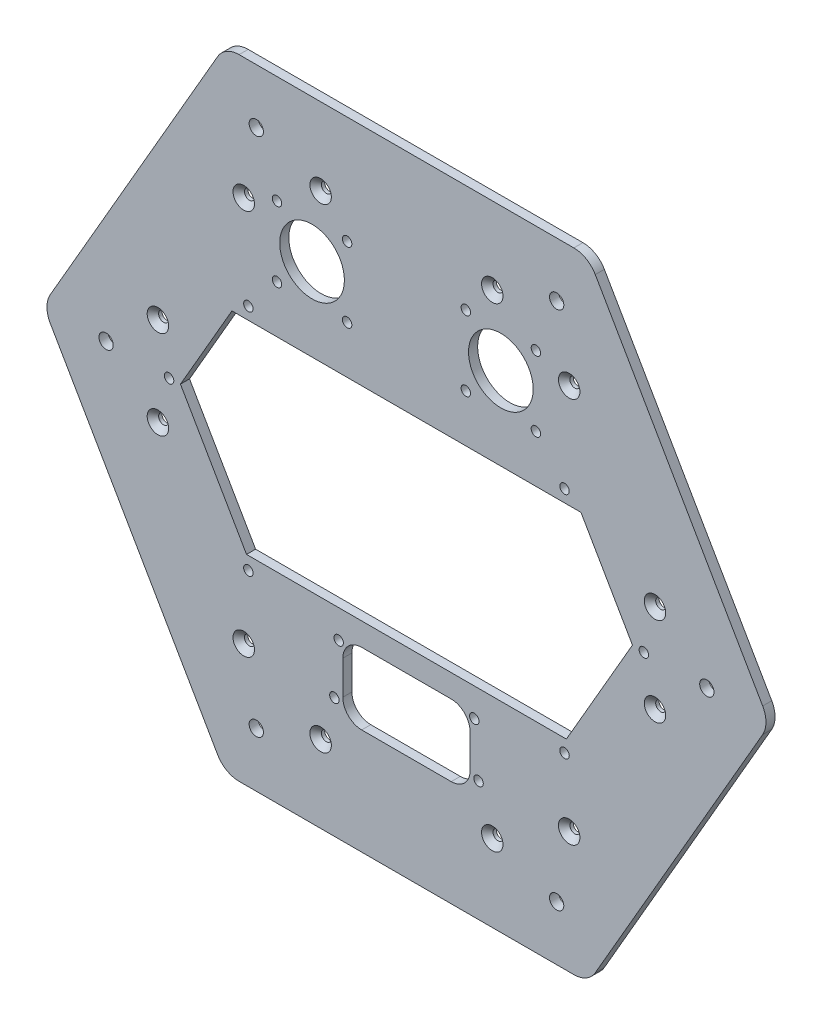
from build123d import *

# Parameters (mm, degrees)
FLANGE_BASE1_DEPTH               = 3.175
ESBO_O6_R                        = 1.65
CORTE_EXTRUS_O1_DEPTH            = 10
ESBO_O8_R                        = 11.3
ESBO_O8_R_2                      = 1.65
CORTE_EXTRUS_O3_DEPTH            = 10
PADR_OCIRCULAR1_COUNT            = 4
ESBO_O7_R                        = 1.75
CORTE_EXTRUS_O2_DEPTH            = 10
CHANFRO1_SIZE                    = 2
PADR_OCIRCULAR2_COUNT            = 6
CHANFRO1_OF_PADR_OCIRCULAR2_SIZE = 2
ESPELHAR1_COPY_1_SKETCH_R        = 11.3
ESPELHAR1_COPY_1_SKETCH_R_2      = 1.65
ESPELHAR1_COPY_1_DEPTH           = 10
ESPELHAR1_COPY_2_SKETCH_R        = 11.3
ESPELHAR1_COPY_2_SKETCH_R_2      = 1.65
ESPELHAR1_COPY_2_DEPTH           = 10
ESPELHAR1_COPY_3_SKETCH_R        = 11.3
ESPELHAR1_COPY_3_SKETCH_R_2      = 1.65
ESPELHAR1_COPY_3_DEPTH           = 10
ESBO_O11_R                       = 2.5
CORTE_EXTRUS_O5_DEPTH            = 10
ESBO_O12_R                       = 1.65
CORTE_EXTRUS_O6_DEPTH            = 10
ESBO_O13_W                       = 376.359651272
ESBO_O13_H                       = 358.929615965
CORTE_EXTRUS_O7_DEPTH            = 10
CAVIDADE1_START                  = -5
CAVIDADE1_DEPTH                  = 10


# Read off the part's stored shape, not the designer's step: Cavidade1
# Sheet-metal steps are written as plain solids
with BuildPart() as part:
    # Esboço1 → Flange-base1 (new body)
    with BuildSketch(Plane.XY):
        Polygon((63.508529611, 110), (127.017059222, 0), (63.508529611, -110), (-63.508529611, -110), (-127.017059222, 0), (-63.508529611, 110), align=None)
        Polygon((61, 31.176914536), (-61, 31.176914536), (-79, 0), (-55.905989232, -40), (55.905989232, -40), (79, 0), align=None, mode=Mode.SUBTRACT)
    extrude(amount=-FLANGE_BASE1_DEPTH)

    # Esboço6 → Corte-extrusão1 (cut)
    with BuildSketch(Plane.XY):
        with BuildLine():
            Line((15.65, -73), (-15.65, -73))
            ThreePointArc((-15.65, -73), (-20.316904756, -71.066904756), (-22.25, -66.4))
            Line((-22.25, -66.4), (-22.25, -54.6))
            ThreePointArc((-22.25, -54.6), (-20.316904756, -49.933095244), (-15.65, -48))
            Line((-15.65, -48), (15.65, -48))
            ThreePointArc((15.65, -48), (20.316904756, -49.933095244), (22.25, -54.6))
            Line((22.25, -54.6), (22.25, -66.4))
            ThreePointArc((22.25, -66.4), (20.316904756, -71.066904756), (15.65, -73))
        make_face()
        with Locations((-23.7, -49.9)):
            Circle(ESBO_O6_R)
        with Locations((23.7, -49.9)):
            Circle(ESBO_O6_R)
        with Locations((25.2, -68)):
            Circle(ESBO_O6_R)
        with Locations((-25.2, -68)):
            Circle(ESBO_O6_R)
    extrude(amount=-CORTE_EXTRUS_O1_DEPTH, mode=Mode.SUBTRACT)

    # Esboço8 → Corte-extrusão3 (cut)
    with BuildSketch(Plane.XY):
        with Locations((-33, 60.0982)):
            Circle(ESBO_O8_R)
        with Locations((-20.75, 47.8482)):
            Circle(ESBO_O8_R_2)
    corte_extrus_o3 = extrude(amount=-CORTE_EXTRUS_O3_DEPTH, mode=Mode.SUBTRACT)

    # PadrãoCircular1: Corte-extrusão3 ×4 about axis
    padr_ocircular1_axis = Axis((-33, 60.0982, 0), (0, 0, 1))
    for i in range(1, PADR_OCIRCULAR1_COUNT):
        add(corte_extrus_o3.rotate(padr_ocircular1_axis, i * 360 / PADR_OCIRCULAR1_COUNT), mode=Mode.SUBTRACT)

    # Esboço7 → Corte-extrusão2 (cut)
    with BuildSketch(Plane.XY):
        with Locations((-30, -83)):
            Circle(ESBO_O7_R)
        with Locations((30, -83)):
            Circle(ESBO_O7_R)
    corte_extrus_o2 = extrude(amount=-CORTE_EXTRUS_O2_DEPTH, mode=Mode.SUBTRACT)

    # Chanfro1
    chanfro1_edges = [part.edges().sort_by_distance(p)[0] for p in [
        (-31.75, -83, 0),
        (28.25, -83, 0),
    ]]
    chamfer(chanfro1_edges, length=CHANFRO1_SIZE)

    # PadrãoCircular2: Corte-extrusão2 ×6 about axis
    padr_ocircular2_axis = Axis((0, 0, 0), (0, 0, 1))
    for i in range(1, PADR_OCIRCULAR2_COUNT):
        add(corte_extrus_o2.rotate(padr_ocircular2_axis, i * 360 / PADR_OCIRCULAR2_COUNT), mode=Mode.SUBTRACT)

    # Chanfro1 of PadrãoCircular2
    chanfro1_of_padr_ocircular2_edges = [part.edges().sort_by_distance(p)[0] for p in [
        (56.005108514, -68.99630657, 0),
        (86.005108514, -17.034782343, 0),
        (87.755108514, 14.00369343, 0),
        (57.755108514, 65.965217657, 0),
        (31.75, 83, 0),
        (-28.25, 83, 0),
        (-56.005108514, 68.99630657, 0),
        (-86.005108514, 17.034782343, 0),
        (-87.755108514, -14.00369343, 0),
        (-57.755108514, -65.965217657, 0),
    ]]
    chamfer(chanfro1_of_padr_ocircular2_edges, length=CHANFRO1_OF_PADR_OCIRCULAR2_SIZE)

    # Espelhar1: Corte-extrusão3 across plane
    add(corte_extrus_o3.mirror(Plane(origin=(0, 0, 0), x_dir=(0, 0, 1), z_dir=(1, 0, 0))), mode=Mode.SUBTRACT)

    # Espelhar1 copy 1 sketch → Espelhar1 copy 1 (cut)
    with BuildSketch(Plane(origin=(-27.0982, 93.0982, 0), x_dir=(0, 1, 0), z_dir=(0, 0, 1))):
        with Locations((-33, -60.0982)):
            Circle(ESPELHAR1_COPY_1_SKETCH_R)
        with Locations((-20.75, -47.8482)):
            Circle(ESPELHAR1_COPY_1_SKETCH_R_2)
    extrude(amount=-ESPELHAR1_COPY_1_DEPTH, mode=Mode.SUBTRACT)

    # Espelhar1 copy 2 sketch → Espelhar1 copy 2 (cut)
    with BuildSketch(Plane(origin=(66, 120.1964, 0), x_dir=(1, 0, 0), z_dir=(0, 0, 1))):
        with Locations((-33, -60.0982)):
            Circle(ESPELHAR1_COPY_2_SKETCH_R)
        with Locations((-20.75, -47.8482)):
            Circle(ESPELHAR1_COPY_2_SKETCH_R_2)
    extrude(amount=-ESPELHAR1_COPY_2_DEPTH, mode=Mode.SUBTRACT)

    # Espelhar1 copy 3 sketch → Espelhar1 copy 3 (cut)
    with BuildSketch(Plane(origin=(93.0982, 27.0982, 0), x_dir=(0, -1, 0), z_dir=(0, 0, 1))):
        with Locations((-33, -60.0982)):
            Circle(ESPELHAR1_COPY_3_SKETCH_R)
        with Locations((-20.75, -47.8482)):
            Circle(ESPELHAR1_COPY_3_SKETCH_R_2)
    extrude(amount=-ESPELHAR1_COPY_3_DEPTH, mode=Mode.SUBTRACT)

    # Esboço11 → Corte-extrusão5 (cut)
    with BuildSketch(Plane(origin=(0, 0, -3.175), x_dir=(-1, 0, 0), z_dir=(0, 0, -1))):
        with Locations((-52.5, 90.932667397)):
            Circle(ESBO_O11_R)
        with Locations((-105, 0)):
            Circle(ESBO_O11_R)
        with Locations((52.5, 90.932667397)):
            Circle(ESBO_O11_R)
        with Locations((105, 0)):
            Circle(ESBO_O11_R)
        with Locations((52.5, -90.932667397)):
            Circle(ESBO_O11_R)
        with Locations((-52.5, -90.932667397)):
            Circle(ESBO_O11_R)
    extrude(amount=-CORTE_EXTRUS_O5_DEPTH, mode=Mode.SUBTRACT)

    # Esboço12 → Corte-extrusão6 (cut)
    with BuildSketch(Plane.XY):
        with Locations((-55.257737945, -44.5259)):
            Circle(ESBO_O12_R)
        with Locations((-82.980762114, -0.195772981)):
            Circle(ESBO_O12_R)
        with Locations((-55.257737945, 35.4741)):
            Circle(ESBO_O12_R)
        with Locations((55.257737945, 35.4741)):
            Circle(ESBO_O12_R)
        with Locations((82.980762114, -0.195772981)):
            Circle(ESBO_O12_R)
        with Locations((55.257737945, -44.5259)):
            Circle(ESBO_O12_R)
    extrude(amount=-CORTE_EXTRUS_O6_DEPTH, mode=Mode.SUBTRACT)

    # Esboço13 → Corte-extrusão7 (cut)
    with BuildSketch(Plane.XY):
        with Locations((17.92855311, -8.326549872)):
            Rectangle(ESBO_O13_W, ESBO_O13_H)
        with BuildLine():
            Line((-66.008529611, 105.669872981), (-124.517059222, 4.330127019))
            ThreePointArc((-124.517059222, 4.330127019), (-125.67731326, 0), (-124.517059222, -4.330127019))
            Line((-124.517059222, -4.330127019), (-66.008529611, -105.669872981))
            ThreePointArc((-66.008529611, -105.669872981), (-62.83865663, -108.839745962), (-58.508529611, -110))
            Line((-58.508529611, -110), (58.508529611, -110))
            ThreePointArc((58.508529611, -110), (62.83865663, -108.839745962), (66.008529611, -105.669872981))
            Line((66.008529611, -105.669872981), (124.517059222, -4.330127019))
            ThreePointArc((124.517059222, -4.330127019), (125.67731326, 0), (124.517059222, 4.330127019))
            Line((124.517059222, 4.330127019), (66.008529611, 105.669872981))
            ThreePointArc((66.008529611, 105.669872981), (62.83865663, 108.839745962), (58.508529611, 110))
            Line((58.508529611, 110), (-58.508529611, 110))
            ThreePointArc((-58.508529611, 110), (-62.83865663, 108.839745962), (-66.008529611, 105.669872981))
        make_face(mode=Mode.SUBTRACT)
    extrude(amount=-CORTE_EXTRUS_O7_DEPTH, mode=Mode.SUBTRACT)

    # Cavidade1 outline → Cavidade1 (cut)
    with BuildSketch(Plane.YZ.offset(CAVIDADE1_START)):
        Polygon((-45.825, -3.175), (-48, -1), (-48, -3.175), align=None)
    extrude(amount=CAVIDADE1_DEPTH, mode=Mode.SUBTRACT)


solid = part.part
